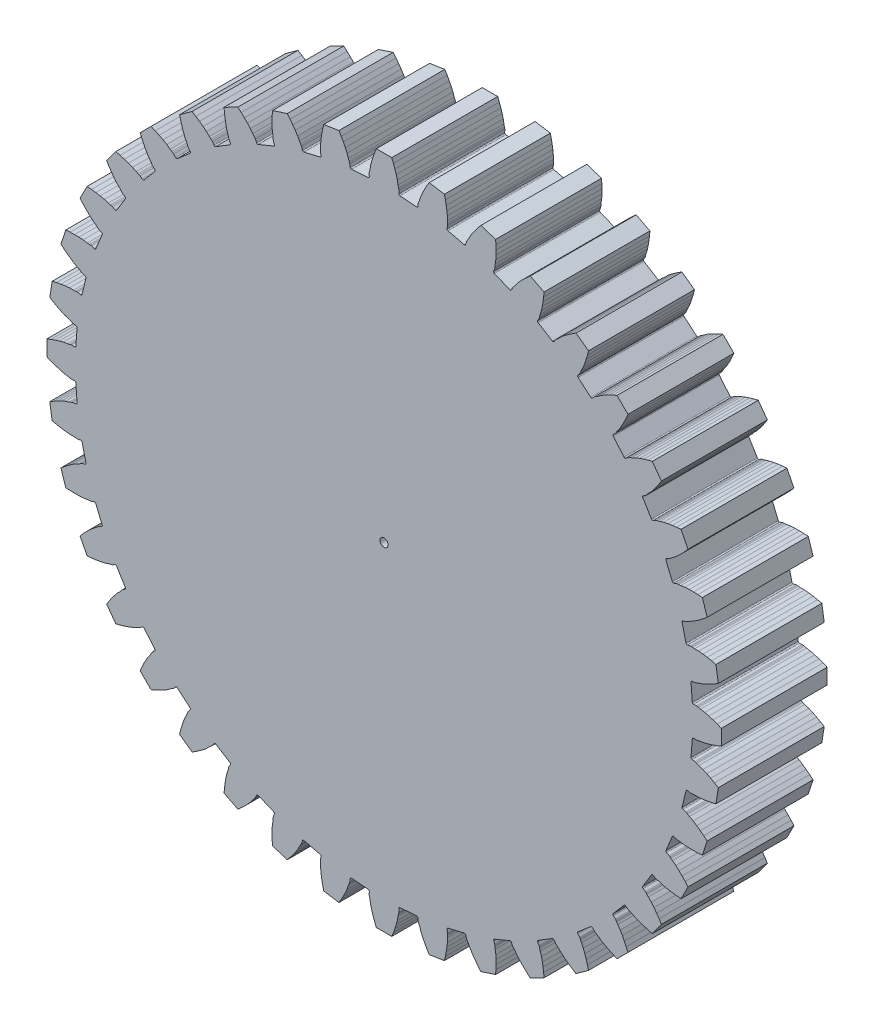
from build123d import *

# Parameters (mm, degrees)
SKETCH1_R          = 0.5
EXTRUDE1_DEPTH     = 13
CUT_EXTRUDE2_DEPTH = 118.821638882
CIRPATTERN2_DEPTH  = 13


# Read off the part's stored shape, not the designer's step: CirPattern2
with BuildPart() as part:
    # Sketch1 → Extrude1 (new body)
    with BuildSketch(Plane.XY):
        Polygon((79.75651, 43.23412), (79.88308, 43.21698), (80.01067, 43.1772), (80.26461, 43.12239), (80.77103, 43.04034), (81.27932, 42.90234), (81.78776, 42.74118), (82.29602, 42.55863), (82.8038, 42.35597), (82.8038, 40.4587), (82.29602, 40.25604), (81.78776, 40.0735), (81.27932, 39.91233), (80.77103, 39.77433), (80.26461, 39.69228), (80.01067, 39.63747), (79.88308, 39.59769), (79.75651, 39.58055), (79.57014, 37.21249), (79.69247, 37.17577), (79.81227, 37.11652), (80.05451, 37.02266), (80.54186, 36.8624), (81.0223, 36.64658), (81.49927, 36.40786), (81.97272, 36.14806), (82.44254, 35.86846), (82.14575, 33.99455), (81.61251, 33.87382), (81.08195, 33.77303), (80.55456, 33.69339), (80.03094, 33.63659), (79.51792, 33.63478), (79.25853, 33.62037), (79.12629, 33.60104), (78.9986, 33.60391), (78.44408, 31.29416), (78.55915, 31.23876), (78.66821, 31.16149), (78.89279, 31.03089), (79.34906, 30.79637), (79.78983, 30.50805), (80.22358, 30.19766), (80.65056, 29.86698), (81.07086, 29.51733), (80.48457, 27.71292), (79.93902, 27.67709), (79.39922, 27.66054), (78.86586, 27.66438), (78.33981, 27.6902), (77.83282, 27.76866), (77.57437, 27.79501), (77.44073, 27.7966), (77.31507, 27.81942), (76.40605, 25.62485), (76.51104, 25.55212), (76.60666, 25.45875), (76.80804, 25.29463), (77.22202, 24.99161), (77.61225, 24.63789), (77.99211, 24.26347), (78.3621, 23.87007), (78.72253, 23.45897), (77.86119, 21.76849), (77.31675, 21.81845), (76.781, 21.88655), (76.25482, 21.97378), (75.73928, 22.08157), (75.25081, 22.23837), (74.99966, 22.30483), (74.86791, 22.32731), (74.74736, 22.3695), (73.50623, 20.34415), (73.59855, 20.2559), (73.67839, 20.14871), (73.85162, 19.95511), (74.21309, 19.59107), (74.54319, 19.18066), (74.85979, 18.75142), (75.16369, 18.30499), (75.45538, 17.84257), (74.34019, 16.30764), (73.81026, 16.44215), (73.29177, 16.59322), (72.78571, 16.76169), (72.29338, 16.94881), (71.83545, 17.18009), (71.59779, 17.28502), (71.47118, 17.32783), (71.35872, 17.38836), (69.81603, 15.5821), (69.89341, 15.48049), (69.9555, 15.36214), (70.09631, 15.14382), (70.39638, 14.72771), (70.65821, 14.27071), (70.90377, 13.79723), (71.13409, 13.30876), (71.34985, 12.8064), (70.00827, 11.46483), (69.50592, 11.68058), (69.01744, 11.9109), (68.54396, 12.15646), (68.08696, 12.41829), (67.67085, 12.71836), (67.45254, 12.85917), (67.33418, 12.92126), (67.23257, 12.99864), (65.42632, 11.45595), (65.48685, 11.34349), (65.52966, 11.21688), (65.63458, 10.97922), (65.86587, 10.52129), (66.05298, 10.02897), (66.22145, 9.5229), (66.37252, 9.00441), (66.50703, 8.47448), (64.97211, 7.3593), (64.50969, 7.65098), (64.06325, 7.95488), (63.63402, 8.27148), (63.22361, 8.60158), (62.85956, 8.96305), (62.66596, 9.13628), (62.55877, 9.21612), (62.47052, 9.30844), (60.44517, 8.06731), (60.48737, 7.94676), (60.50984, 7.81501), (60.5763, 7.56387), (60.7331, 7.0754), (60.84089, 6.55986), (60.92812, 6.03367), (60.99622, 5.49793), (61.04618, 4.95348), (59.3557, 4.09214), (58.9446, 4.45257), (58.5512, 4.82257), (58.17678, 5.20242), (57.82306, 5.59266), (57.52004, 6.00663), (57.35593, 6.20801), (57.26255, 6.30364), (57.18982, 6.40863), (54.99526, 5.49961), (55.01807, 5.37394), (55.01966, 5.2403), (55.04601, 4.98185), (55.12447, 4.47486), (55.15029, 3.94881), (55.15413, 3.41545), (55.13758, 2.87565), (55.10175, 2.3301), (53.29734, 1.74381), (52.94769, 2.16412), (52.61702, 2.59109), (52.30662, 3.02485), (52.0183, 3.46561), (51.78378, 3.92189), (51.65318, 4.14646), (51.57592, 4.25552), (51.52051, 4.37059), (49.21076, 3.81607), (49.21364, 3.68839), (49.1943, 3.55614), (49.1799, 3.29675), (49.17808, 2.78373), (49.12129, 2.26011), (49.04164, 1.73272), (48.94086, 1.20216), (48.82013, 0.66893), (46.94621, 0.37213), (46.66662, 0.84196), (46.40681, 1.31541), (46.16809, 1.79237), (45.95227, 2.27281), (45.79201, 2.76016), (45.69816, 3.0024), (45.6389, 3.1222), (45.60218, 3.24453), (43.23412, 3.05816), (43.21698, 2.93159), (43.1772, 2.804), (43.12239, 2.55006), (43.04034, 2.04364), (42.90234, 1.53535), (42.74118, 1.02691), (42.55863, 0.51865), (42.35597, 0.01087), (40.4587, 0.01087), (40.25604, 0.51865), (40.0735, 1.02691), (39.91233, 1.53535), (39.77433, 2.04364), (39.69228, 2.55006), (39.63747, 2.804), (39.59769, 2.93159), (39.58055, 3.05816), (37.21249, 3.24453), (37.17577, 3.1222), (37.11652, 3.0024), (37.02266, 2.76016), (36.8624, 2.27281), (36.64658, 1.79237), (36.40786, 1.31541), (36.14806, 0.84196), (35.86846, 0.37213), (33.99455, 0.66893), (33.87382, 1.20216), (33.77303, 1.73272), (33.69339, 2.26011), (33.63659, 2.78373), (33.63478, 3.29675), (33.62037, 3.55614), (33.60104, 3.68839), (33.60391, 3.81607), (31.29416, 4.37059), (31.23876, 4.25552), (31.16149, 4.14646), (31.03089, 3.92189), (30.79637, 3.46561), (30.50805, 3.02485), (30.19766, 2.59109), (29.86698, 2.16412), (29.51733, 1.74381), (27.71292, 2.3301), (27.67709, 2.87565), (27.66054, 3.41545), (27.66438, 3.94881), (27.6902, 4.47486), (27.76866, 4.98185), (27.79501, 5.2403), (27.7966, 5.37394), (27.81942, 5.49961), (25.62485, 6.40863), (25.55212, 6.30364), (25.45875, 6.20801), (25.29463, 6.00663), (24.99161, 5.59266), (24.63789, 5.20242), (24.26347, 4.82257), (23.87007, 4.45257), (23.45897, 4.09214), (21.76849, 4.95348), (21.81845, 5.49793), (21.88655, 6.03367), (21.97378, 6.55986), (22.08157, 7.0754), (22.23837, 7.56387), (22.30483, 7.81501), (22.32731, 7.94676), (22.3695, 8.06731), (20.34415, 9.30844), (20.2559, 9.21612), (20.14871, 9.13628), (19.95511, 8.96305), (19.59107, 8.60158), (19.18066, 8.27148), (18.75142, 7.95488), (18.30499, 7.65098), (17.84257, 7.3593), (16.30764, 8.47448), (16.44215, 9.00441), (16.59322, 9.5229), (16.76169, 10.02897), (16.94881, 10.52129), (17.18009, 10.97922), (17.28502, 11.21688), (17.32783, 11.34349), (17.38836, 11.45595), (15.5821, 12.99864), (15.48049, 12.92126), (15.36214, 12.85917), (15.14382, 12.71836), (14.72771, 12.41829), (14.27071, 12.15646), (13.79723, 11.9109), (13.30876, 11.68058), (12.8064, 11.46483), (11.46483, 12.8064), (11.68058, 13.30876), (11.9109, 13.79723), (12.15646, 14.27071), (12.41829, 14.72771), (12.71836, 15.14382), (12.85917, 15.36214), (12.92126, 15.48049), (12.99864, 15.5821), (11.45595, 17.38836), (11.34349, 17.32783), (11.21688, 17.28502), (10.97922, 17.18009), (10.52129, 16.94881), (10.02897, 16.76169), (9.5229, 16.59322), (9.00441, 16.44215), (8.47448, 16.30764), (7.3593, 17.84257), (7.65098, 18.30499), (7.95488, 18.75142), (8.27148, 19.18066), (8.60158, 19.59107), (8.96305, 19.95511), (9.13628, 20.14871), (9.21612, 20.2559), (9.30844, 20.34415), (8.06731, 22.3695), (7.94676, 22.32731), (7.81501, 22.30483), (7.56387, 22.23837), (7.0754, 22.08157), (6.55986, 21.97378), (6.03367, 21.88655), (5.49793, 21.81845), (4.95348, 21.76849), (4.09214, 23.45897), (4.45257, 23.87007), (4.82257, 24.26347), (5.20242, 24.63789), (5.59266, 24.99161), (6.00663, 25.29463), (6.20801, 25.45875), (6.30364, 25.55212), (6.40863, 25.62485), (5.49961, 27.81942), (5.37394, 27.7966), (5.2403, 27.79501), (4.98185, 27.76866), (4.47486, 27.6902), (3.94881, 27.66438), (3.41545, 27.66054), (2.87565, 27.67709), (2.3301, 27.71292), (1.74381, 29.51733), (2.16412, 29.86698), (2.59109, 30.19766), (3.02485, 30.50805), (3.46561, 30.79637), (3.92189, 31.03089), (4.14646, 31.16149), (4.25552, 31.23876), (4.37059, 31.29416), (3.81607, 33.60391), (3.68839, 33.60104), (3.55614, 33.62037), (3.29675, 33.63478), (2.78373, 33.63659), (2.26011, 33.69339), (1.73272, 33.77303), (1.20216, 33.87382), (0.66893, 33.99455), (0.37213, 35.86846), (0.84196, 36.14806), (1.31541, 36.40786), (1.79237, 36.64658), (2.27281, 36.8624), (2.76016, 37.02266), (3.0024, 37.11652), (3.1222, 37.17577), (3.24453, 37.21249), (3.05816, 39.58055), (2.93159, 39.59769), (2.804, 39.63747), (2.55006, 39.69228), (2.04364, 39.77433), (1.53535, 39.91233), (1.02691, 40.0735), (0.51865, 40.25604), (0.01087, 40.4587), (0.01087, 42.35597), (0.51865, 42.55863), (1.02691, 42.74118), (1.53535, 42.90234), (2.04364, 43.04034), (2.55006, 43.12239), (2.804, 43.1772), (2.93159, 43.21698), (3.05816, 43.23412), (3.24453, 45.60218), (3.1222, 45.6389), (3.0024, 45.69816), (2.76016, 45.79201), (2.27281, 45.95227), (1.79237, 46.16809), (1.31541, 46.40681), (0.84196, 46.66662), (0.37213, 46.94621), (0.66893, 48.82013), (1.20216, 48.94086), (1.73272, 49.04164), (2.26011, 49.12129), (2.78373, 49.17808), (3.29675, 49.1799), (3.55614, 49.1943), (3.68839, 49.21364), (3.81607, 49.21076), (4.37059, 51.52051), (4.25552, 51.57592), (4.14646, 51.65318), (3.92189, 51.78378), (3.46561, 52.0183), (3.02485, 52.30662), (2.59109, 52.61702), (2.16412, 52.94769), (1.74381, 53.29734), (2.3301, 55.10175), (2.87565, 55.13758), (3.41545, 55.15413), (3.94881, 55.15029), (4.47486, 55.12447), (4.98185, 55.04601), (5.2403, 55.01966), (5.37394, 55.01807), (5.49961, 54.99526), (6.40863, 57.18982), (6.30364, 57.26255), (6.20801, 57.35593), (6.00663, 57.52004), (5.59266, 57.82306), (5.20242, 58.17678), (4.82257, 58.5512), (4.45257, 58.9446), (4.09214, 59.3557), (4.95348, 61.04618), (5.49793, 60.99622), (6.03367, 60.92812), (6.55986, 60.84089), (7.0754, 60.7331), (7.56387, 60.5763), (7.81501, 60.50984), (7.94676, 60.48737), (8.06731, 60.44517), (9.30844, 62.47052), (9.21612, 62.55877), (9.13628, 62.66596), (8.96305, 62.85956), (8.60158, 63.22361), (8.27148, 63.63402), (7.95488, 64.06325), (7.65098, 64.50969), (7.3593, 64.97211), (8.47448, 66.50703), (9.00441, 66.37252), (9.5229, 66.22145), (10.02897, 66.05298), (10.52129, 65.86587), (10.97922, 65.63458), (11.21688, 65.52966), (11.34349, 65.48685), (11.45595, 65.42632), (12.99864, 67.23257), (12.92126, 67.33418), (12.85917, 67.45254), (12.71836, 67.67085), (12.41829, 68.08696), (12.15646, 68.54396), (11.9109, 69.01744), (11.68058, 69.50592), (11.46483, 70.00827), (12.8064, 71.34985), (13.30876, 71.13409), (13.79723, 70.90377), (14.27071, 70.65821), (14.72771, 70.39638), (15.14382, 70.09631), (15.36214, 69.9555), (15.48049, 69.89341), (15.5821, 69.81603), (17.38836, 71.35872), (17.32783, 71.47118), (17.28502, 71.59779), (17.18009, 71.83545), (16.94881, 72.29338), (16.76169, 72.78571), (16.59322, 73.29177), (16.44215, 73.81026), (16.30764, 74.34019), (17.84257, 75.45538), (18.30499, 75.16369), (18.75142, 74.85979), (19.18066, 74.54319), (19.59107, 74.21309), (19.95511, 73.85162), (20.14871, 73.67839), (20.2559, 73.59855), (20.34415, 73.50623), (22.3695, 74.74736), (22.32731, 74.86791), (22.30483, 74.99966), (22.23837, 75.25081), (22.08157, 75.73928), (21.97378, 76.25482), (21.88655, 76.781), (21.81845, 77.31675), (21.76849, 77.86119), (23.45897, 78.72253), (23.87007, 78.3621), (24.26347, 77.99211), (24.63789, 77.61225), (24.99161, 77.22202), (25.29463, 76.80804), (25.45875, 76.60666), (25.55212, 76.51104), (25.62485, 76.40605), (27.81942, 77.31507), (27.7966, 77.44073), (27.79501, 77.57437), (27.76866, 77.83282), (27.6902, 78.33981), (27.66438, 78.86586), (27.66054, 79.39922), (27.67709, 79.93902), (27.71292, 80.48457), (29.51733, 81.07086), (29.86698, 80.65056), (30.19766, 80.22358), (30.50805, 79.78983), (30.79637, 79.34906), (31.03089, 78.89279), (31.16149, 78.66821), (31.23876, 78.55915), (31.29416, 78.44408), (33.60391, 78.9986), (33.60104, 79.12629), (33.62037, 79.25853), (33.63478, 79.51792), (33.63659, 80.03094), (33.69339, 80.55456), (33.77303, 81.08195), (33.87382, 81.61251), (33.99455, 82.14575), (35.86846, 82.44254), (36.14806, 81.97272), (36.40786, 81.49927), (36.64658, 81.0223), (36.8624, 80.54186), (37.02266, 80.05451), (37.11652, 79.81227), (37.17577, 79.69247), (37.21249, 79.57014), (39.58055, 79.75651), (39.59769, 79.88308), (39.63747, 80.01067), (39.69228, 80.26461), (39.77433, 80.77103), (39.91233, 81.27932), (40.0735, 81.78776), (40.25604, 82.29602), (40.4587, 82.8038), (42.35597, 82.8038), (42.55863, 82.29602), (42.74118, 81.78776), (42.90234, 81.27932), (43.04034, 80.77103), (43.12239, 80.26461), (43.1772, 80.01067), (43.21698, 79.88308), (43.23412, 79.75651), (45.60218, 79.57014), (45.6389, 79.69247), (45.69816, 79.81227), (45.79201, 80.05451), (45.95227, 80.54186), (46.16809, 81.0223), (46.40681, 81.49927), (46.66662, 81.97272), (46.94621, 82.44254), (48.82013, 82.14575), (48.94086, 81.61251), (49.04164, 81.08195), (49.12129, 80.55456), (49.17808, 80.03094), (49.1799, 79.51792), (49.1943, 79.25853), (49.21364, 79.12629), (49.21076, 78.9986), (51.52051, 78.44408), (51.57592, 78.55915), (51.65318, 78.66821), (51.78378, 78.89279), (52.0183, 79.34906), (52.30662, 79.78983), (52.61702, 80.22358), (52.94769, 80.65056), (53.29734, 81.07086), (55.10175, 80.48457), (55.13758, 79.93902), (55.15413, 79.39922), (55.15029, 78.86586), (55.12447, 78.33981), (55.04601, 77.83282), (55.01966, 77.57437), (55.01807, 77.44073), (54.99526, 77.31507), (57.18982, 76.40605), (57.26255, 76.51104), (57.35593, 76.60666), (57.52004, 76.80804), (57.82306, 77.22202), (58.17678, 77.61225), (58.5512, 77.99211), (58.9446, 78.3621), (59.3557, 78.72253), (61.04618, 77.86119), (60.99622, 77.31675), (60.92812, 76.781), (60.84089, 76.25482), (60.7331, 75.73928), (60.5763, 75.25081), (60.50984, 74.99966), (60.48737, 74.86791), (60.44517, 74.74736), (62.47052, 73.50623), (62.55877, 73.59855), (62.66596, 73.67839), (62.85956, 73.85162), (63.22361, 74.21309), (63.63402, 74.54319), (64.06325, 74.85979), (64.50969, 75.16369), (64.97211, 75.45538), (66.50703, 74.34019), (66.37252, 73.81026), (66.22145, 73.29177), (66.05298, 72.78571), (65.86587, 72.29338), (65.63458, 71.83545), (65.52966, 71.59779), (65.48685, 71.47118), (65.42632, 71.35872), (67.23257, 69.81603), (67.33418, 69.89341), (67.45254, 69.9555), (67.67085, 70.09631), (68.08696, 70.39638), (68.54396, 70.65821), (69.01744, 70.90377), (69.50592, 71.13409), (70.00827, 71.34985), (71.34985, 70.00827), (71.13409, 69.50592), (70.90377, 69.01744), (70.65821, 68.54396), (70.39638, 68.08696), (70.09631, 67.67085), (69.9555, 67.45254), (69.89341, 67.33418), (69.81603, 67.23257), (71.35872, 65.42632), (71.47118, 65.48685), (71.59779, 65.52966), (71.83545, 65.63458), (72.29338, 65.86587), (72.78571, 66.05298), (73.29177, 66.22145), (73.81026, 66.37252), (74.34019, 66.50703), (75.45538, 64.97211), (75.16369, 64.50969), (74.85979, 64.06325), (74.54319, 63.63402), (74.21309, 63.22361), (73.85162, 62.85956), (73.67839, 62.66596), (73.59855, 62.55877), (73.50623, 62.47052), (74.74736, 60.44517), (74.86791, 60.48737), (74.99966, 60.50984), (75.25081, 60.5763), (75.73928, 60.7331), (76.25482, 60.84089), (76.781, 60.92812), (77.31675, 60.99622), (77.86119, 61.04618), (78.72253, 59.3557), (78.3621, 58.9446), (77.99211, 58.5512), (77.61225, 58.17678), (77.22202, 57.82306), (76.80804, 57.52004), (76.60666, 57.35593), (76.51104, 57.26255), (76.40605, 57.18982), (77.31507, 54.99526), (77.44073, 55.01807), (77.57437, 55.01966), (77.83282, 55.04601), (78.33981, 55.12447), (78.86586, 55.15029), (79.39922, 55.15413), (79.93902, 55.13758), (80.48457, 55.10175), (81.07086, 53.29734), (80.65056, 52.94769), (80.22358, 52.61702), (79.78983, 52.30662), (79.34906, 52.0183), (78.89279, 51.78378), (78.66821, 51.65318), (78.55915, 51.57592), (78.44408, 51.52051), (78.9986, 49.21076), (79.12629, 49.21364), (79.25853, 49.1943), (79.51792, 49.1799), (80.03094, 49.17808), (80.55456, 49.12129), (81.08195, 49.04164), (81.61251, 48.94086), (82.14575, 48.82013), (82.44254, 46.94621), (81.97272, 46.66662), (81.49927, 46.40681), (81.0223, 46.16809), (80.54186, 45.95227), (80.05451, 45.79201), (79.81227, 45.69816), (79.69247, 45.6389), (79.57014, 45.60218), align=None)
        with Locations((41.40734, 41.40734)):
            Circle(SKETCH1_R, mode=Mode.SUBTRACT)
    extrude(amount=EXTRUDE1_DEPTH)

    # Sketch2 → Cut-Extrude2 (cut, through all)
    with BuildSketch(Plane.XY.offset(13)):
        with BuildLine():
            Line((43.23412, 79.75651), (43.296155771, 79.936710456))
            Line((43.296155771, 79.936710456), (45.579602633, 79.75651))
            Line((45.579602633, 79.75651), (45.60218, 79.57014))
            Line((45.60218, 79.57014), (45.563412903, 79.217454092))
            ThreePointArc((45.563412903, 79.217454092), (45.509952039, 79.118289084), (45.402542106, 79.084305719))
            Line((45.402542106, 79.084305719), (43.355298866, 79.245426942))
            ThreePointArc((43.355298866, 79.245426942), (43.25452747, 79.295794513), (43.217237604, 79.402101768))
            Line((43.217237604, 79.402101768), (43.23412, 79.75651))
        make_face()
    extrude(amount=-CUT_EXTRUDE2_DEPTH, mode=Mode.SUBTRACT)

    # CirPattern2 outline → CirPattern2 (cut)
    with BuildSketch(Plane.XY):
        with BuildLine():
            Line((51.52051, 78.44408), (49.21076, 78.9986))
            Line((49.21076, 78.9986), (49.138644993, 78.651192839))
            ThreePointArc((49.138644993, 78.651192839), (49.15884564, 78.540360982), (49.250497149, 78.4748494))
            Line((49.250497149, 78.4748494), (51.247330515, 77.995452446))
            ThreePointArc((51.247330515, 77.995452446), (51.358734223, 78.012214804), (51.427049721, 78.101795804))
            Line((51.427049721, 78.101795804), (51.52051, 78.44408))
        make_face()
        with BuildLine():
            Line((57.18982, 76.40605), (54.99526, 77.31507))
            Line((54.99526, 77.31507), (54.869681994, 76.983216647))
            ThreePointArc((54.869681994, 76.983216647), (54.872296016, 76.870589237), (54.952570873, 76.791546756))
            Line((54.952570873, 76.791546756), (56.849825701, 76.005678415))
            ThreePointArc((56.849825701, 76.005678415), (56.962480055, 76.004807021), (57.043968031, 76.082598233))
            Line((57.043968031, 76.082598233), (57.18982, 76.40605))
        make_face()
        with BuildLine():
            Line((62.47052, 73.50623), (60.44517, 74.74736))
            Line((60.44517, 74.74736), (60.269231456, 74.439244303))
            ThreePointArc((60.269231456, 74.439244303), (60.254194486, 74.3275946), (60.321116059, 74.236967509))
            Line((60.321116059, 74.236967509), (62.072075638, 73.163978467))
            ThreePointArc((62.072075638, 73.163978467), (62.183206714, 73.145494777), (62.275860664, 73.209580722))
            Line((62.275860664, 73.209580722), (62.47052, 73.50623))
        make_face()
        with BuildLine():
            Line((67.23257, 69.81603), (65.42632, 71.35872))
            Line((65.42632, 71.35872), (65.204338552, 71.081916848))
            ThreePointArc((65.204338552, 71.081916848), (65.17202085, 70.973994039), (65.223941307, 70.874013877))
            Line((65.223941307, 70.874013877), (66.785491201, 69.540324685))
            ThreePointArc((66.785491201, 69.540324685), (66.892362583, 69.504683831), (66.99390106, 69.5534865))
            Line((66.99390106, 69.5534865), (67.23257, 69.81603))
        make_face()
        with BuildLine():
            Line((71.35872, 65.42632), (69.81603, 67.23257))
            Line((69.81603, 67.23257), (69.553484565, 66.993902827))
            ThreePointArc((69.553484565, 66.993902827), (69.504681901, 66.892364329), (69.540322788, 66.78549294))
            Line((69.540322788, 66.78549294), (70.874012456, 65.223943453))
            ThreePointArc((70.874012456, 65.223943453), (70.973992616, 65.172023029), (71.081915405, 65.204340739))
            Line((71.081915405, 65.204340739), (71.35872, 65.42632))
        make_face()
        with BuildLine():
            Line((74.74736, 60.44517), (73.50623, 62.47052))
            Line((73.50623, 62.47052), (73.209579088, 62.275862712))
            ThreePointArc((73.209579088, 62.275862712), (73.145493145, 62.18320874), (73.163976864, 62.072077652))
            Line((73.163976864, 62.072077652), (74.236966441, 60.321118401))
            ThreePointArc((74.236966441, 60.321118401), (74.327593536, 60.254196861), (74.43924322, 60.269233842))
            Line((74.43924322, 60.269233842), (74.74736, 60.44517))
        make_face()
        with BuildLine():
            Line((77.31507, 54.99526), (76.40605, 57.18982))
            Line((76.40605, 57.18982), (76.082596938, 57.043970309))
            ThreePointArc((76.082596938, 57.043970309), (76.004805726, 56.962482311), (76.005677147, 56.849827941))
            Line((76.005677147, 56.849827941), (76.791546068, 54.952573353))
            ThreePointArc((76.791546068, 54.952573353), (76.870588557, 54.872298527), (76.983215951, 54.86968452))
            Line((76.983215951, 54.86968452), (77.31507, 54.99526))
        make_face()
        with BuildLine():
            Line((78.9986, 49.21076), (78.44408, 51.52051))
            Line((78.44408, 51.52051), (78.101794882, 51.427052173))
            ThreePointArc((78.101794882, 51.427052173), (78.012213877, 51.358736655), (77.995451544, 51.247332926))
            Line((77.995451544, 51.247332926), (78.474849108, 49.250499707))
            ThreePointArc((78.474849108, 49.250499707), (78.540360704, 49.158848227), (78.651192547, 49.138647597))
            Line((78.651192547, 49.138647597), (78.9986, 49.21076))
        make_face()
        with BuildLine():
            Line((79.75651, 43.23412), (79.57014, 45.60218))
            Line((79.57014, 45.60218), (79.217453566, 45.56341547))
            ThreePointArc((79.217453566, 45.56341547), (79.11828855, 45.509954586), (79.084305206, 45.402544629))
            Line((79.084305206, 45.402544629), (79.245427054, 43.355301438))
            ThreePointArc((79.245427054, 43.355301438), (79.295794643, 43.254530069), (79.402101887, 43.217240222))
            Line((79.402101887, 43.217240222), (79.75651, 43.23412))
        make_face()
        with BuildLine():
            Line((79.57014, 37.21249), (79.75651, 39.58055))
            Line((79.75651, 39.58055), (79.402101768, 39.597442396))
            ThreePointArc((79.402101768, 39.597442396), (79.295794513, 39.56015253), (79.245426942, 39.459381134))
            Line((79.245426942, 39.459381134), (79.084305719, 37.412137894))
            ThreePointArc((79.084305719, 37.412137894), (79.118289084, 37.304727961), (79.217454092, 37.251267097))
            Line((79.217454092, 37.251267097), (79.57014, 37.21249))
        make_face()
        with BuildLine():
            Line((78.44408, 31.29416), (78.9986, 33.60391))
            Line((78.9986, 33.60391), (78.651192839, 33.676035007))
            ThreePointArc((78.651192839, 33.676035007), (78.540360982, 33.65583436), (78.4748494, 33.564182851))
            Line((78.4748494, 33.564182851), (77.995452446, 31.567349485))
            ThreePointArc((77.995452446, 31.567349485), (78.012214804, 31.455945777), (78.101795804, 31.387630279))
            Line((78.101795804, 31.387630279), (78.44408, 31.29416))
        make_face()
        with BuildLine():
            Line((76.40605, 25.62485), (77.31507, 27.81942))
            Line((77.31507, 27.81942), (76.983216647, 27.944998006))
            ThreePointArc((76.983216647, 27.944998006), (76.870589237, 27.942383984), (76.791546756, 27.862109127))
            Line((76.791546756, 27.862109127), (76.005678415, 25.964854299))
            ThreePointArc((76.005678415, 25.964854299), (76.004807021, 25.852199945), (76.082598233, 25.770711969))
            Line((76.082598233, 25.770711969), (76.40605, 25.62485))
        make_face()
        with BuildLine():
            Line((73.50623, 20.34415), (74.74736, 22.3695))
            Line((74.74736, 22.3695), (74.439244303, 22.545448544))
            ThreePointArc((74.439244303, 22.545448544), (74.3275946, 22.560485514), (74.236967509, 22.493563941))
            Line((74.236967509, 22.493563941), (73.163978467, 20.742604362))
            ThreePointArc((73.163978467, 20.742604362), (73.145494777, 20.631473286), (73.209580722, 20.538819336))
            Line((73.209580722, 20.538819336), (73.50623, 20.34415))
        make_face()
        with BuildLine():
            Line((69.81603, 15.5821), (71.35872, 17.38836))
            Line((71.35872, 17.38836), (71.081916848, 17.610341448))
            ThreePointArc((71.081916848, 17.610341448), (70.973994039, 17.64265915), (70.874013877, 17.590738693))
            Line((70.874013877, 17.590738693), (69.540324685, 16.029188799))
            ThreePointArc((69.540324685, 16.029188799), (69.504683831, 15.922317417), (69.5534865, 15.82077894))
            Line((69.5534865, 15.82077894), (69.81603, 15.5821))
        make_face()
        with BuildLine():
            Line((65.42632, 11.45595), (67.23257, 12.99864))
            Line((67.23257, 12.99864), (66.993902827, 13.261195435))
            ThreePointArc((66.993902827, 13.261195435), (66.892364329, 13.309998099), (66.78549294, 13.274357212))
            Line((66.78549294, 13.274357212), (65.223943453, 11.940667544))
            ThreePointArc((65.223943453, 11.940667544), (65.172023029, 11.840687384), (65.204340739, 11.732764595))
            Line((65.204340739, 11.732764595), (65.42632, 11.45595))
        make_face()
        with BuildLine():
            Line((60.44517, 8.06731), (62.47052, 9.30844))
            Line((62.47052, 9.30844), (62.275862712, 9.605100912))
            ThreePointArc((62.275862712, 9.605100912), (62.18320874, 9.669186855), (62.072077652, 9.650703136))
            Line((62.072077652, 9.650703136), (60.321118401, 8.577713559))
            ThreePointArc((60.321118401, 8.577713559), (60.254196861, 8.487086464), (60.269233842, 8.37543678))
            Line((60.269233842, 8.37543678), (60.44517, 8.06731))
        make_face()
        with BuildLine():
            Line((54.99526, 5.49961), (57.18982, 6.40863))
            Line((57.18982, 6.40863), (57.043970309, 6.732083062))
            ThreePointArc((57.043970309, 6.732083062), (56.962482311, 6.809874274), (56.849827941, 6.809002853))
            Line((56.849827941, 6.809002853), (54.952573353, 6.023133932))
            ThreePointArc((54.952573353, 6.023133932), (54.872298527, 5.944091443), (54.86968452, 5.831464049))
            Line((54.86968452, 5.831464049), (54.99526, 5.49961))
        make_face()
        with BuildLine():
            Line((49.21076, 3.81607), (51.52051, 4.37059))
            Line((51.52051, 4.37059), (51.427052173, 4.712885118))
            ThreePointArc((51.427052173, 4.712885118), (51.358736655, 4.802466123), (51.247332926, 4.819228456))
            Line((51.247332926, 4.819228456), (49.250499707, 4.339830892))
            ThreePointArc((49.250499707, 4.339830892), (49.158848227, 4.274319296), (49.138647597, 4.163487453))
            Line((49.138647597, 4.163487453), (49.21076, 3.81607))
        make_face()
        with BuildLine():
            Line((43.23412, 3.05816), (45.60218, 3.24453))
            Line((45.60218, 3.24453), (45.56341547, 3.597226434))
            ThreePointArc((45.56341547, 3.597226434), (45.509954586, 3.69639145), (45.402544629, 3.730374794))
            Line((45.402544629, 3.730374794), (43.355301438, 3.569252946))
            ThreePointArc((43.355301438, 3.569252946), (43.254530069, 3.518885357), (43.217240222, 3.412578113))
            Line((43.217240222, 3.412578113), (43.23412, 3.05816))
        make_face()
        with BuildLine():
            Line((37.21249, 3.24453), (39.58055, 3.05816))
            Line((39.58055, 3.05816), (39.597442396, 3.412578232))
            ThreePointArc((39.597442396, 3.412578232), (39.56015253, 3.518885487), (39.459381134, 3.569253058))
            Line((39.459381134, 3.569253058), (37.412137894, 3.730374281))
            ThreePointArc((37.412137894, 3.730374281), (37.304727961, 3.696390916), (37.251267097, 3.597225908))
            Line((37.251267097, 3.597225908), (37.21249, 3.24453))
        make_face()
        with BuildLine():
            Line((31.29416, 4.37059), (33.60391, 3.81607))
            Line((33.60391, 3.81607), (33.676035007, 4.163487161))
            ThreePointArc((33.676035007, 4.163487161), (33.65583436, 4.274319018), (33.564182851, 4.3398306))
            Line((33.564182851, 4.3398306), (31.567349485, 4.819227554))
            ThreePointArc((31.567349485, 4.819227554), (31.455945777, 4.802465196), (31.387630279, 4.712884196))
            Line((31.387630279, 4.712884196), (31.29416, 4.37059))
        make_face()
        with BuildLine():
            Line((25.62485, 6.40863), (27.81942, 5.49961))
            Line((27.81942, 5.49961), (27.944998006, 5.831463353))
            ThreePointArc((27.944998006, 5.831463353), (27.942383984, 5.944090763), (27.862109127, 6.023133244))
            Line((27.862109127, 6.023133244), (25.964854299, 6.809001585))
            ThreePointArc((25.964854299, 6.809001585), (25.852199945, 6.809872979), (25.770711969, 6.732081767))
            Line((25.770711969, 6.732081767), (25.62485, 6.40863))
        make_face()
        with BuildLine():
            Line((20.34415, 9.30844), (22.3695, 8.06731))
            Line((22.3695, 8.06731), (22.545448544, 8.375435697))
            ThreePointArc((22.545448544, 8.375435697), (22.560485514, 8.4870854), (22.493563941, 8.577712491))
            Line((22.493563941, 8.577712491), (20.742604362, 9.650701533))
            ThreePointArc((20.742604362, 9.650701533), (20.631473286, 9.669185223), (20.538819336, 9.605099278))
            Line((20.538819336, 9.605099278), (20.34415, 9.30844))
        make_face()
        with BuildLine():
            Line((15.5821, 12.99864), (17.38836, 11.45595))
            Line((17.38836, 11.45595), (17.610341448, 11.732763152))
            ThreePointArc((17.610341448, 11.732763152), (17.64265915, 11.840685961), (17.590738693, 11.940666123))
            Line((17.590738693, 11.940666123), (16.029188799, 13.274355315))
            ThreePointArc((16.029188799, 13.274355315), (15.922317417, 13.309996169), (15.82077894, 13.2611935))
            Line((15.82077894, 13.2611935), (15.5821, 12.99864))
        make_face()
        with BuildLine():
            Line((11.45595, 17.38836), (12.99864, 15.5821))
            Line((12.99864, 15.5821), (13.261195435, 15.820777173))
            ThreePointArc((13.261195435, 15.820777173), (13.309998099, 15.922315671), (13.274357212, 16.02918706))
            Line((13.274357212, 16.02918706), (11.940667544, 17.590736547))
            ThreePointArc((11.940667544, 17.590736547), (11.840687384, 17.642656971), (11.732764595, 17.610339261))
            Line((11.732764595, 17.610339261), (11.45595, 17.38836))
        make_face()
        with BuildLine():
            Line((8.06731, 22.3695), (9.30844, 20.34415))
            Line((9.30844, 20.34415), (9.605100912, 20.538817288))
            ThreePointArc((9.605100912, 20.538817288), (9.669186855, 20.63147126), (9.650703136, 20.742602348))
            Line((9.650703136, 20.742602348), (8.577713559, 22.493561599))
            ThreePointArc((8.577713559, 22.493561599), (8.487086464, 22.560483139), (8.37543678, 22.545446158))
            Line((8.37543678, 22.545446158), (8.06731, 22.3695))
        make_face()
        with BuildLine():
            Line((5.49961, 27.81942), (6.40863, 25.62485))
            Line((6.40863, 25.62485), (6.732083062, 25.770709691))
            ThreePointArc((6.732083062, 25.770709691), (6.809874274, 25.852197689), (6.809002853, 25.964852059))
            Line((6.809002853, 25.964852059), (6.023133932, 27.862106647))
            ThreePointArc((6.023133932, 27.862106647), (5.944091443, 27.942381473), (5.831464049, 27.94499548))
            Line((5.831464049, 27.94499548), (5.49961, 27.81942))
        make_face()
        with BuildLine():
            Line((3.81607, 33.60391), (4.37059, 31.29416))
            Line((4.37059, 31.29416), (4.712885118, 31.387627827))
            ThreePointArc((4.712885118, 31.387627827), (4.802466123, 31.455943345), (4.819228456, 31.567347074))
            Line((4.819228456, 31.567347074), (4.339830892, 33.564180293))
            ThreePointArc((4.339830892, 33.564180293), (4.274319296, 33.655831773), (4.163487453, 33.676032403))
            Line((4.163487453, 33.676032403), (3.81607, 33.60391))
        make_face()
        with BuildLine():
            Line((3.05816, 39.58055), (3.24453, 37.21249))
            Line((3.24453, 37.21249), (3.597226434, 37.25126453))
            ThreePointArc((3.597226434, 37.25126453), (3.69639145, 37.304725414), (3.730374794, 37.412135371))
            Line((3.730374794, 37.412135371), (3.569252946, 39.459378562))
            ThreePointArc((3.569252946, 39.459378562), (3.518885357, 39.560149931), (3.412578113, 39.597439778))
            Line((3.412578113, 39.597439778), (3.05816, 39.58055))
        make_face()
        with BuildLine():
            Line((3.24453, 45.60218), (3.05816, 43.23412))
            Line((3.05816, 43.23412), (3.412578232, 43.217237604))
            ThreePointArc((3.412578232, 43.217237604), (3.518885487, 43.25452747), (3.569253058, 43.355298866))
            Line((3.569253058, 43.355298866), (3.730374281, 45.402542106))
            ThreePointArc((3.730374281, 45.402542106), (3.696390916, 45.509952039), (3.597225908, 45.563412903))
            Line((3.597225908, 45.563412903), (3.24453, 45.60218))
        make_face()
        with BuildLine():
            Line((4.37059, 51.52051), (3.81607, 49.21076))
            Line((3.81607, 49.21076), (4.163487161, 49.138644993))
            ThreePointArc((4.163487161, 49.138644993), (4.274319018, 49.15884564), (4.3398306, 49.250497149))
            Line((4.3398306, 49.250497149), (4.819227554, 51.247330515))
            ThreePointArc((4.819227554, 51.247330515), (4.802465196, 51.358734223), (4.712884196, 51.427049721))
            Line((4.712884196, 51.427049721), (4.37059, 51.52051))
        make_face()
        with BuildLine():
            Line((6.40863, 57.18982), (5.49961, 54.99526))
            Line((5.49961, 54.99526), (5.831463353, 54.869681994))
            ThreePointArc((5.831463353, 54.869681994), (5.944090763, 54.872296016), (6.023133244, 54.952570873))
            Line((6.023133244, 54.952570873), (6.809001585, 56.849825701))
            ThreePointArc((6.809001585, 56.849825701), (6.809872979, 56.962480055), (6.732081767, 57.043968031))
            Line((6.732081767, 57.043968031), (6.40863, 57.18982))
        make_face()
        with BuildLine():
            Line((9.30844, 62.47052), (8.06731, 60.44517))
            Line((8.06731, 60.44517), (8.375435697, 60.269231456))
            ThreePointArc((8.375435697, 60.269231456), (8.4870854, 60.254194486), (8.577712491, 60.321116059))
            Line((8.577712491, 60.321116059), (9.650701533, 62.072075638))
            ThreePointArc((9.650701533, 62.072075638), (9.669185223, 62.183206714), (9.605099278, 62.275860664))
            Line((9.605099278, 62.275860664), (9.30844, 62.47052))
        make_face()
        with BuildLine():
            Line((12.99864, 67.23257), (11.45595, 65.42632))
            Line((11.45595, 65.42632), (11.732763152, 65.204338552))
            ThreePointArc((11.732763152, 65.204338552), (11.840685961, 65.17202085), (11.940666123, 65.223941307))
            Line((11.940666123, 65.223941307), (13.274355315, 66.785491201))
            ThreePointArc((13.274355315, 66.785491201), (13.309996169, 66.892362583), (13.2611935, 66.99390106))
            Line((13.2611935, 66.99390106), (12.99864, 67.23257))
        make_face()
        with BuildLine():
            Line((17.38836, 71.35872), (15.5821, 69.81603))
            Line((15.5821, 69.81603), (15.820777173, 69.553484565))
            ThreePointArc((15.820777173, 69.553484565), (15.922315671, 69.504681901), (16.02918706, 69.540322788))
            Line((16.02918706, 69.540322788), (17.590736547, 70.874012456))
            ThreePointArc((17.590736547, 70.874012456), (17.642656971, 70.973992616), (17.610339261, 71.081915405))
            Line((17.610339261, 71.081915405), (17.38836, 71.35872))
        make_face()
        with BuildLine():
            Line((22.3695, 74.74736), (20.34415, 73.50623))
            Line((20.34415, 73.50623), (20.538817288, 73.209579088))
            ThreePointArc((20.538817288, 73.209579088), (20.63147126, 73.145493145), (20.742602348, 73.163976864))
            Line((20.742602348, 73.163976864), (22.493561599, 74.236966441))
            ThreePointArc((22.493561599, 74.236966441), (22.560483139, 74.327593536), (22.545446158, 74.43924322))
            Line((22.545446158, 74.43924322), (22.3695, 74.74736))
        make_face()
        with BuildLine():
            Line((27.81942, 77.31507), (25.62485, 76.40605))
            Line((25.62485, 76.40605), (25.770709691, 76.082596938))
            ThreePointArc((25.770709691, 76.082596938), (25.852197689, 76.004805726), (25.964852059, 76.005677147))
            Line((25.964852059, 76.005677147), (27.862106647, 76.791546068))
            ThreePointArc((27.862106647, 76.791546068), (27.942381473, 76.870588557), (27.94499548, 76.983215951))
            Line((27.94499548, 76.983215951), (27.81942, 77.31507))
        make_face()
        with BuildLine():
            Line((33.60391, 78.9986), (31.29416, 78.44408))
            Line((31.29416, 78.44408), (31.387627827, 78.101794882))
            ThreePointArc((31.387627827, 78.101794882), (31.455943345, 78.012213877), (31.567347074, 77.995451544))
            Line((31.567347074, 77.995451544), (33.564180293, 78.474849108))
            ThreePointArc((33.564180293, 78.474849108), (33.655831773, 78.540360704), (33.676032403, 78.651192547))
            Line((33.676032403, 78.651192547), (33.60391, 78.9986))
        make_face()
        with BuildLine():
            Line((39.58055, 79.75651), (37.21249, 79.57014))
            Line((37.21249, 79.57014), (37.25126453, 79.217453566))
            ThreePointArc((37.25126453, 79.217453566), (37.304725414, 79.11828855), (37.412135371, 79.084305206))
            Line((37.412135371, 79.084305206), (39.459378562, 79.245427054))
            ThreePointArc((39.459378562, 79.245427054), (39.560149931, 79.295794643), (39.597439778, 79.402101887))
            Line((39.597439778, 79.402101887), (39.58055, 79.75651))
        make_face()
    extrude(amount=CIRPATTERN2_DEPTH, mode=Mode.SUBTRACT)


solid = part.part
